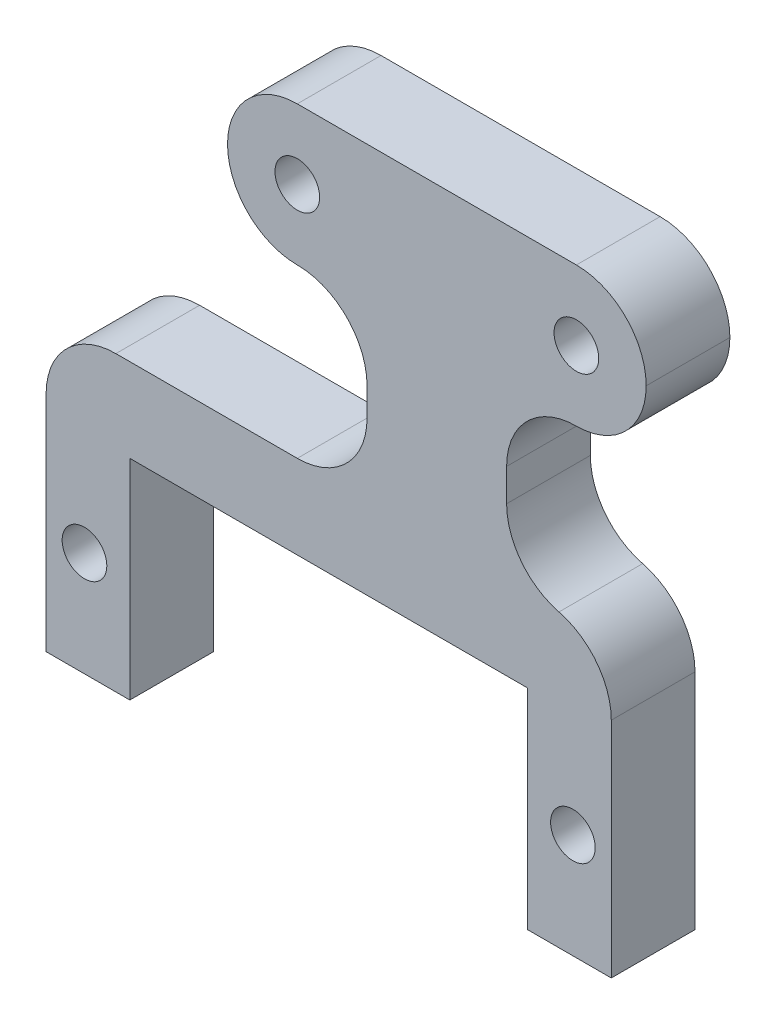
from build123d import *

# Parameters (mm, degrees)
BOSS_EXTRU_1_DEPTH      = 6
ESQUISSE2_R             = 1.6
ENL_V_MAT_EXTRU_1_DEPTH = 10
ESQUISSE4_R             = 1.6
ENL_V_MAT_EXTRU_2_DEPTH = 37.572701568
CHANFREIN1_SIZE         = 2.1
CONG_1_R                = 5
CONG_2_R                = 5


with BuildPart() as part:
    # Esquisse1 → Boss.-Extru.1 (new body)
    with BuildSketch(Plane.XY):
        Polygon((12.75, 18), (22.75, 18), (22.75, 28), (-7.25, 28), (-7.25, 18), (2.75, 18), (2.75, 6), (-20.25, 6), (-20.25, 0), (-20.25, -15), (-14.25, -15), (-14.25, 0), (14.25, 0), (14.25, -15), (20.25, -15), (20.25, -0.694767442), (20.25, 6), (12.75, 6), align=None)
    extrude(amount=BOSS_EXTRU_1_DEPTH)

    # Esquisse2 → Enlèv. mat.-Extru.1 (cut)
    with BuildSketch(Plane.XY.offset(6)):
        with Locations((-17.5, -7.5)):
            Circle(ESQUISSE2_R)
        with Locations((17.5, -7.5)):
            Circle(ESQUISSE2_R)
    extrude(amount=-ENL_V_MAT_EXTRU_1_DEPTH, mode=Mode.SUBTRACT)

    # Esquisse4 → Enlèv. mat.-Extru.2 (cut, through all)
    with BuildSketch(Plane(origin=(0, 0, 0), x_dir=(-1, 0, 0), z_dir=(0, 0, -1))):
        with Locations((-17.75, 23)):
            Circle(ESQUISSE4_R)
        with Locations((2.25, 23)):
            Circle(ESQUISSE4_R)
    extrude(amount=-ENL_V_MAT_EXTRU_2_DEPTH, mode=Mode.SUBTRACT)

    # Chanfrein1
    chanfrein1_edges = [part.edges().sort_by_distance(p)[0] for p in [
        (19.35, 23, 0),
        (-0.65, 23, 0),
    ]]
    chamfer(chanfrein1_edges, length=CHANFREIN1_SIZE)

    # Congé1
    cong_1_edges = [part.edges().sort_by_distance(p)[0] for p in [
        (2.75, 6, 3),
        (-20.25, 6, 3),
        (20.25, 6, 3),
        (-7.25, 28, 3),
        (-7.25, 18, 3),
        (2.75, 18, 3),
        (12.75, 18, 3),
        (22.75, 18, 3),
        (22.75, 28, 3),
    ]]
    fillet(cong_1_edges, radius=CONG_1_R - 0.0001)  # a hair under: the kernel refuses the full size

    # Congé2
    cong_2_edges = [part.edges().sort_by_distance(p)[0] for p in [
        (12.75, 6, 3),
    ]]
    fillet(cong_2_edges, radius=CONG_2_R)


solid = part.part
